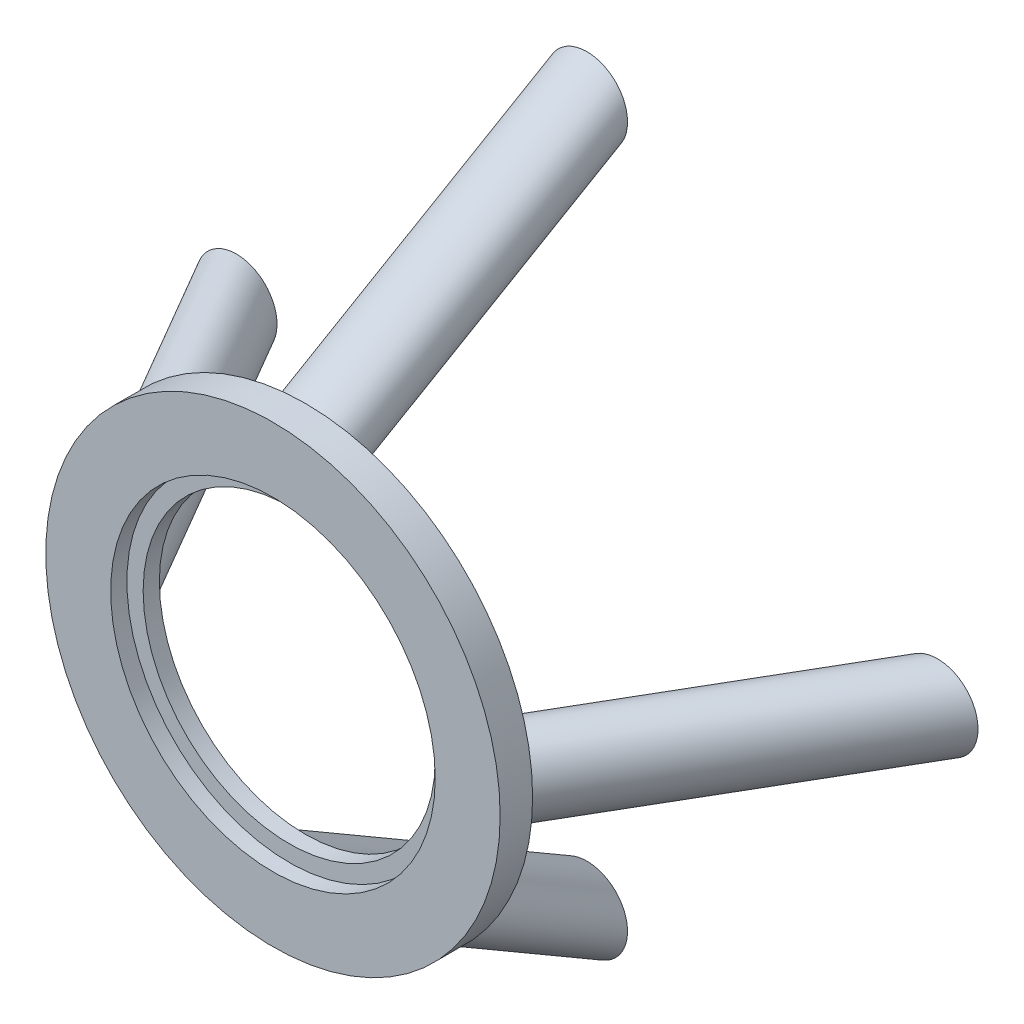
from build123d import *

# Parameters (mm, degrees)
SKETCH1_R           = 70
SKETCH1_R_2         = 50
BOSS_EXTRUDE1_DEPTH = 10
SKETCH1_6_R         = 50
SKETCH1_6_R_2       = 45
BOSS_EXTRUDE3_DEPTH = 5
SKETCH2_R           = 12.5
CIRPATTERN2_COUNT   = 4


with BuildPart() as part:
    # Sketch1 → Boss-Extrude1 (new body)
    with BuildSketch(Plane.XY):
        Circle(SKETCH1_R)
        Circle(SKETCH1_R_2, mode=Mode.SUBTRACT)
    extrude(amount=BOSS_EXTRUDE1_DEPTH)

    # Sketch1<6> → Boss-Extrude3 (add)
    with BuildSketch(Plane.XY):
        Circle(SKETCH1_6_R)
        Circle(SKETCH1_6_R_2, mode=Mode.SUBTRACT)
    extrude(amount=BOSS_EXTRUDE3_DEPTH)

    # Sweep1: sweep along a path in Sketch3
    with BuildLine(Plane(origin=(0, 0, 0), x_dir=(0, 0, -1), z_dir=(1, 0, 0))) as sweep1_path:
        Line((0, -57.5), (86.731949901, -107.982962913))
    # Sketch2 → Sweep1 (sweep)
    with BuildSketch(Plane(origin=(0, 0, 0), x_dir=(-1, 0, 0), z_dir=(0, 0, -1))):
        with Locations((0, -57.5)):
            Circle(SKETCH2_R)
    sweep1 = sweep(path=sweep1_path.line)

    # CirPattern2: Sweep1 ×4 about axis
    cirpattern2_axis = Axis((0, 0, 10), (0, 0, -1))
    for i in range(1, CIRPATTERN2_COUNT):
        add(sweep1.rotate(cirpattern2_axis, i * 360 / CIRPATTERN2_COUNT))


solid = part.part
